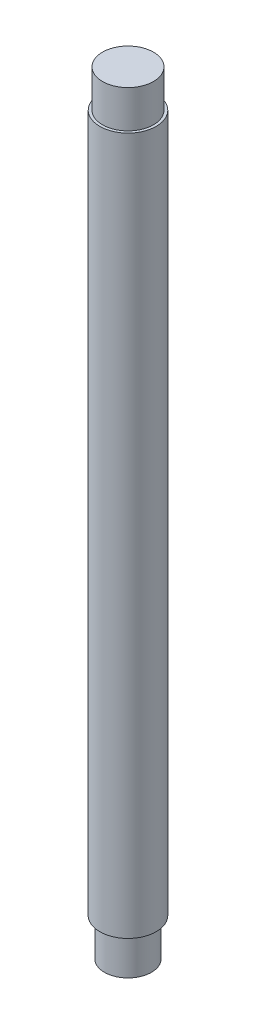
from build123d import *

# Parameters (mm, degrees)
SKETCH2_R           = 9.525
BOSS_EXTRUDE1_DEPTH = 236
SKETCH3_R           = 8.621005773
BOSS_EXTRUDE2_DEPTH = 12.7
SKETCH4_R           = 7.9375
BOSS_EXTRUDE3_DEPTH = 12.7


with BuildPart() as part:
    # Sketch2 → Boss-Extrude1 (new body)
    with BuildSketch(Plane(origin=(0, 0, 0), x_dir=(1, 0, 0), z_dir=(0, 1, 0))):
        Circle(SKETCH2_R)
    extrude(amount=BOSS_EXTRUDE1_DEPTH)

    # Sketch3 → Boss-Extrude2 (add)
    with BuildSketch(Plane(origin=(0, 236, 0), x_dir=(1, 0, 0), z_dir=(0, 1, 0))):
        Circle(SKETCH3_R)
    extrude(amount=BOSS_EXTRUDE2_DEPTH)

    # Sketch4 → Boss-Extrude3 (add)
    with BuildSketch(Plane.XZ):
        Circle(SKETCH4_R)
    extrude(amount=BOSS_EXTRUDE3_DEPTH)


solid = part.part
